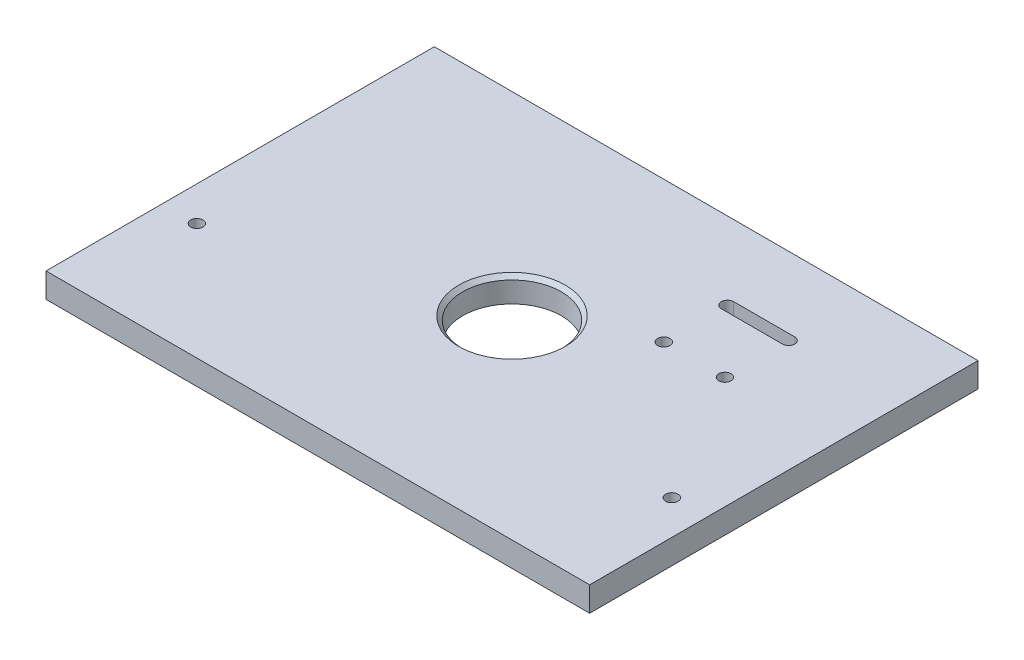
from build123d import *

# Parameters (mm, degrees)
SKETCH1_W           = 140
SKETCH1_H           = 100
BOSS_EXTRUDE1_DEPTH = 6.35
SKETCH2_R           = 12.705
CUT_EXTRUDE1_DEPTH  = 10
SKETCH3_R           = 1.5875
CUT_EXTRUDE2_DEPTH  = 10
CHAMFER1_SIZE       = 1
SKETCH4_R           = 1.5875
CUT_EXTRUDE4_DEPTH  = 10


with BuildPart() as part:
    # Sketch1 → Boss-Extrude1 (new body)
    with BuildSketch(Plane(origin=(0, 0, 0), x_dir=(1, 0, 0), z_dir=(0, 1, 0))):
        with Locations((70, 50)):
            Rectangle(SKETCH1_W, SKETCH1_H)
    extrude(amount=BOSS_EXTRUDE1_DEPTH)

    # Sketch2 → Cut-Extrude1 (cut)
    with BuildSketch(Plane(origin=(0, 6.35, 0), x_dir=(1, 0, 0), z_dir=(0, 1, 0))):
        with Locations((70, 50)):
            Circle(SKETCH2_R)
    extrude(amount=-CUT_EXTRUDE1_DEPTH, mode=Mode.SUBTRACT)

    # Sketch3 → Cut-Extrude2 (cut)
    with BuildSketch(Plane(origin=(0, 6.35, 0), x_dir=(1, 0, 0), z_dir=(0, 1, 0))):
        with Locations((8.85, 30)):
            Circle(SKETCH3_R)
        with Locations((131.15, 30)):
            Circle(SKETCH3_R)
    extrude(amount=-CUT_EXTRUDE2_DEPTH, mode=Mode.SUBTRACT)

    # Chamfer1
    chamfer1_edges = [part.edges().sort_by_distance(p)[0] for p in [
        (57.295, 6.35, -50),
    ]]
    chamfer(chamfer1_edges, length=CHAMFER1_SIZE)

    # Sketch4 → Cut-Extrude4 (cut)
    with BuildSketch(Plane(origin=(0, 6.35, 0), x_dir=(1, 0, 0), z_dir=(0, 1, 0))):
        with BuildLine():
            Line((111.13, 81.6925), (95.4, 81.6925))
            ThreePointArc((95.4, 81.6925), (93.8125, 80.105), (95.4, 78.5175))
            Line((95.4, 78.5175), (111.13, 78.5175))
            ThreePointArc((111.13, 78.5175), (112.7175, 80.105), (111.13, 81.6925))
        make_face()
        with Locations((95.4, 63.705)):
            Circle(SKETCH4_R)
        with Locations((111.13, 63.705)):
            Circle(SKETCH4_R)
    extrude(amount=-CUT_EXTRUDE4_DEPTH, mode=Mode.SUBTRACT)


solid = part.part
